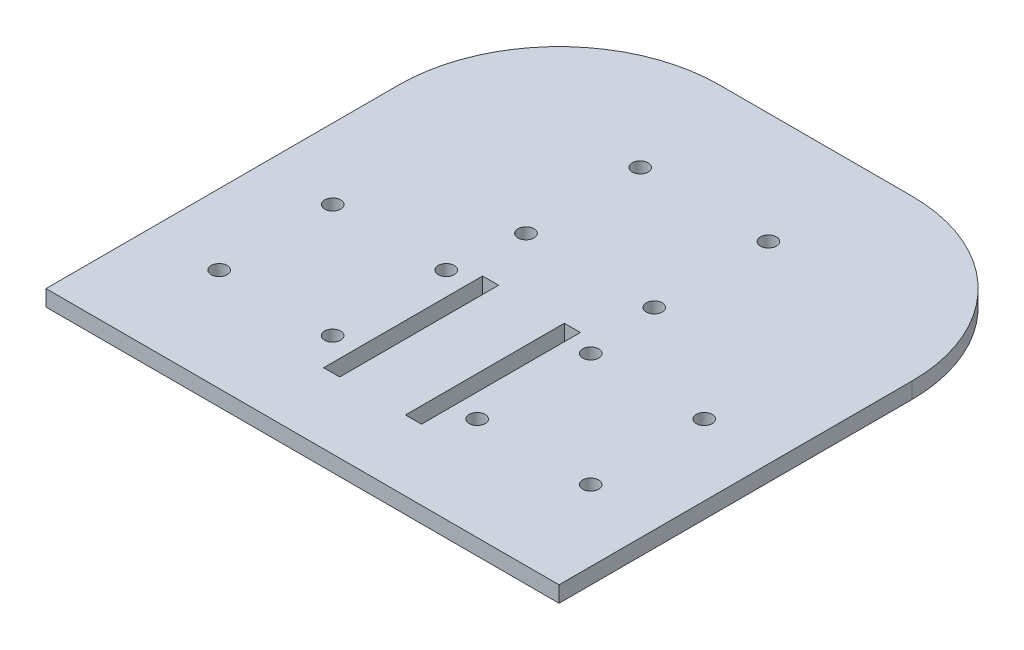
from build123d import *

# Parameters (mm, degrees)
SKETCH1_W           = 203.2
SKETCH1_H           = 203.2
BOSS_EXTRUDE1_DEPTH = 6.35
CUT_EXTRUDE1_DEPTH  = 144.824345992
SKETCH10_R          = 3.175
SKETCH10_W          = 6.35
SKETCH10_H          = 62.924217451
CUT_EXTRUDE4_DEPTH  = 144.824345992


with BuildPart() as part:
    # Sketch1 → Boss-Extrude1 (new body)
    with BuildSketch(Plane(origin=(0, 0, 0), x_dir=(1, 0, 0), z_dir=(0, 1, 0))):
        Rectangle(SKETCH1_W, SKETCH1_H)
    extrude(amount=BOSS_EXTRUDE1_DEPTH)

    # Sketch2 → Cut-Extrude1 (cut, through all)
    with BuildSketch(Plane(origin=(0, 6.35, 0), x_dir=(1, 0, 0), z_dir=(0, 1, 0))):
        with BuildLine():
            Line((101.6, 38.1), (101.6, 101.6))
            Line((101.6, 101.6), (38.1, 101.6))
            ThreePointArc((38.1, 101.6), (83.001280605, 83.001280605), (101.6, 38.1))
        make_face()
        with BuildLine():
            Line((-38.1, 101.6), (-101.6, 101.6))
            Line((-101.6, 101.6), (-101.6, 38.1))
            ThreePointArc((-101.6, 38.1), (-83.001280605, 83.001280605), (-38.1, 101.6))
        make_face()
    extrude(amount=-CUT_EXTRUDE1_DEPTH, mode=Mode.SUBTRACT)

    # Sketch10 → Cut-Extrude4 (cut, through all)
    with BuildSketch(Plane.XZ):
        with Locations((25.309743879, -12.40083867)):
            Circle(SKETCH10_R)
        with Locations((-25.490256121, -12.40083867)):
            Circle(SKETCH10_R)
        with Locations((-25.490256121, -57.61283867)):
            Circle(SKETCH10_R)
        with Locations((25.309743879, -57.61283867)):
            Circle(SKETCH10_R)
        with Locations((-73.66, 16.002)):
            Circle(SKETCH10_R)
        with Locations((-73.66, 60.965705209)):
            Circle(SKETCH10_R)
        with Locations((-28.696294791, 60.965705209)):
            Circle(SKETCH10_R)
        with Locations((-28.696294791, 16.002)):
            Circle(SKETCH10_R)
        with Locations((28.515782549, 60.965705209)):
            Circle(SKETCH10_R)
        with Locations((73.479487758, 60.965705209)):
            Circle(SKETCH10_R)
        with Locations((73.479487758, 16.002)):
            Circle(SKETCH10_R)
        with Locations((28.515782549, 16.002)):
            Circle(SKETCH10_R)
        with Locations((-16.28703867, 42.293852605)):
            Rectangle(SKETCH10_W, SKETCH10_H)
        with Locations((16.106526428, 42.293852605)):
            Rectangle(SKETCH10_W, SKETCH10_H)
    extrude(amount=-CUT_EXTRUDE4_DEPTH, mode=Mode.SUBTRACT)


solid = part.part
